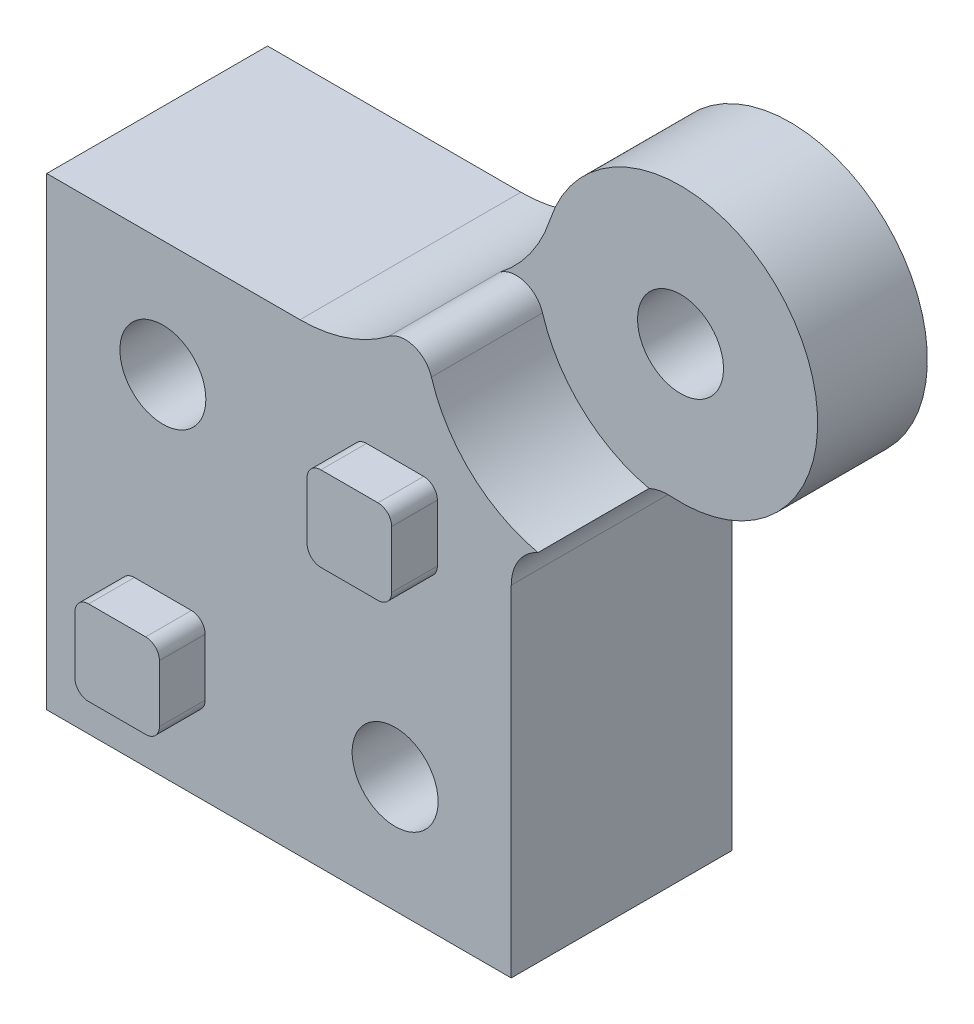
from build123d import *

# Parameters (mm, degrees)
SKETCH2_R             = 2.35
BOSS_EXTRUDE1_DEPTH   = 2.5
BOSS_EXTRUDE1_2_DEPTH = 2.5
SKETCH2_W             = 4.6228
SKETCH2_H             = 4.6228
BOSS_EXTRUDE1_3_DEPTH = 2.5
BOSS_EXTRUDE1_4_DEPTH = 2.5
BOSS_EXTRUDE2_DEPTH   = 6.075
SKETCH6_R             = 2.35
CUT_EXTRUDE1_DEPTH    = 201.98763799
SKETCH4_R             = 7.5
SKETCH4_R_2           = 2.35
BOSS_EXTRUDE4_DEPTH   = 6
FILLET2_R             = 2.5
FILLET3_R             = 8
SKETCH7_R             = 2.35
CUT_EXTRUDE2_DEPTH    = 215.594236042
FILLET4_R             = 1.5
FILLET5_R             = 0.75


with BuildPart() as part:
    # Sketch2 → Boss-Extrude1 (new body)
    with BuildSketch(Plane.XY):
        with Locations((44.45, 184.15)):
            Circle(SKETCH2_R)
    extrude(amount=BOSS_EXTRUDE1_DEPTH)


with BuildPart() as body_2:
    # Sketch2 → Boss-Extrude1 2 (new body)
    with BuildSketch(Plane.XY):
        with Locations((57.15, 171.45)):
            Circle(SKETCH2_R)
    extrude(amount=BOSS_EXTRUDE1_2_DEPTH)


with BuildPart() as body_3:
    # Sketch2 → Boss-Extrude1 3 (new body)
    with BuildSketch(Plane.XY):
        with Locations((57.15, 184.15)):
            Rectangle(SKETCH2_W, SKETCH2_H)
    extrude(amount=BOSS_EXTRUDE1_3_DEPTH)



with BuildPart() as body_4:
    # Sketch2 → Boss-Extrude1 4 (new body)
    with BuildSketch(Plane.XY):
        with Locations((44.45, 171.45)):
            Rectangle(SKETCH2_W, SKETCH2_H)
    extrude(amount=BOSS_EXTRUDE1_4_DEPTH)


with BuildPart() as body_3_1:
    add(body_3.part)

    add(body_4.part)  # Boss-Extrude2 merges body 4
    # Sketch3 → Boss-Extrude2 (add)
    with BuildSketch(Plane.XY):
        with BuildLine():
            Line((63.5, 186.4614), (63.5, 165.1))
            Line((63.5, 165.1), (38.1, 165.1))
            Line((38.1, 165.1), (38.1, 190.5))
            Line((38.1, 190.5), (59.4614, 190.5))
            ThreePointArc((59.4614, 190.5), (61.102474131, 188.102474131), (63.5, 186.4614))
        make_face()
    extrude(amount=-BOSS_EXTRUDE2_DEPTH)


with BuildPart() as cut_extrude1_tool:
    # Sketch6 → Cut-Extrude1 (new, through all)
    with BuildSketch(Plane.XY.offset(2.5)):
        with Locations((44.45, 184.15)):
            Circle(SKETCH6_R)
        with Locations((57.15, 171.45)):
            Circle(SKETCH6_R)
    extrude(amount=-CUT_EXTRUDE1_DEPTH)


with BuildPart() as part_1:
    add(part.part)

    # Cut-Extrude1: cut by cut_extrude1_tool
    add(cut_extrude1_tool.part, mode=Mode.SUBTRACT)


with BuildPart() as body_2_1:
    add(body_2.part)

    # Cut-Extrude1: cut by cut_extrude1_tool
    add(cut_extrude1_tool.part, mode=Mode.SUBTRACT)


with BuildPart() as body_3_2:
    add(body_3_1.part)

    # Cut-Extrude1: cut by cut_extrude1_tool
    add(cut_extrude1_tool.part, mode=Mode.SUBTRACT)

    # Sketch4 → Boss-Extrude4 (add)
    # profile 1 of 3: a face of its own
    with BuildSketch(Plane(origin=(0, 0, -6.075), x_dir=(-1, 0, 0), z_dir=(0, 0, -1))):
        with Locations((-66.681980515, 193.681980515)):
            Circle(SKETCH4_R)
        with Locations((-66.681980515, 193.681980515)):
            Circle(SKETCH4_R_2, mode=Mode.SUBTRACT)
    # profile 2 of 3: a face of its own
    with BuildSketch(Plane(origin=(0, 0, -6.075), x_dir=(-1, 0, 0), z_dir=(0, 0, -1))):
        with BuildLine():
            Line((-38.1, 190.5), (-59.4614, 190.5))
            ThreePointArc((-59.4614, 190.5), (-61.102474131, 188.102474131), (-63.5, 186.4614))
            Line((-63.5, 186.4614), (-63.5, 165.1))
            Line((-63.5, 165.1), (-38.1, 165.1))
            Line((-38.1, 165.1), (-38.1, 190.5))
        make_face()
    # profile 3 of 3: a face of its own
    with BuildSketch(Plane(origin=(0, 0, -6.075), x_dir=(-1, 0, 0), z_dir=(0, 0, -1))):
        with BuildLine():
            ThreePointArc((-63.5, 186.4614), (-61.102474131, 188.102474131), (-59.4614, 190.5))
            Line((-59.4614, 190.5), (-59.890441662, 190.5))
            ThreePointArc((-59.890441662, 190.5), (-61.378679656, 188.378679656), (-63.5, 186.890441662))
            Line((-63.5, 186.890441662), (-63.5, 186.4614))
        make_face()
    extrude(amount=BOSS_EXTRUDE4_DEPTH)

    # Fillet2
    fillet2_edges = [body_3_2.edges().sort_by_distance(p)[0] for p in [
        (63.5, 186.890441662, -9.075),
    ]]
    fillet(fillet2_edges, radius=FILLET2_R)

    # Fillet3
    # the kernel refuses this fillet: 8 mm, written as the material it adds along each edge
    with BuildSketch(Plane(origin=(59.890441662, 190.5, 13.776565592), x_dir=(-1, 0, 0), z_dir=(0, 0, -1))) as fillet3_piece_1_section:
        with BuildLine():
            CenterArc((7.940626237, 8), FILLET3_R, 198.10985807, 71.89014193)
            ThreePointArc((0.336928126, 5.513280266), (0.694495171, 2.724493268), (0, 0))
            Line((0, 0), (7.940626237, 0))
        make_face()
    fillet3_piece_1 = extrude(amount=25.851565592, mode=Mode.PRIVATE)
    fillet3_piece_1 = fillet3_piece_1 - Plane(origin=(66.681980515, 193.681980515, -3.0375), x_dir=(-0.9150847933660875, -0.40326147962599274, 0), z_dir=(0, 0, 1)) * Cylinder(7.8906136, 84, mode=Mode.PRIVATE)
    fillet3_piece_1 = split(fillet3_piece_1, bisect_by=Plane(origin=(57.125105601, 191.419685935, 0), z_dir=(0, 0, -1)), keep=Keep.TOP, mode=Mode.PRIVATE)
    fillet3_piece_1 = split(fillet3_piece_1, bisect_by=Plane(origin=(57.125105601, 191.419685935, -6.075), z_dir=(0, 0, 1)), keep=Keep.TOP, mode=Mode.PRIVATE)
    add(fillet3_piece_1)
    with BuildSketch(Plane(origin=(59.890441662, 190.5, -6.075), x_dir=(-1, 0, 0), z_dir=(0, 0, -1))) as fillet3_piece_2_section:
        with BuildLine():
            CenterArc((7.940626237, 8), FILLET3_R, 198.10985807, 71.89014193)
            ThreePointArc((0.336928126, 5.513280266), (0.694495171, 2.724493268), (0, 0))
            Line((0, 0), (7.940626237, 0))
        make_face()
    fillet3_piece_2 = extrude(amount=6, mode=Mode.PRIVATE)
    fillet3_piece_2 = fillet3_piece_2 - Plane(origin=(66.681980515, 193.681980515, -9.075), x_dir=(-0.9150847933660875, -0.40326147962599274, 0), z_dir=(0, 0, 1)) * Cylinder(7.8906136, 44, mode=Mode.PRIVATE)
    add(fillet3_piece_2)
    with BuildSketch(Plane(origin=(59.890441662, 190.5, -6.075), x_dir=(-1, 0, 0), z_dir=(0, 0, -1))) as fillet3_piece_3_section:
        with BuildLine():
            CenterArc((7.940626237, 8), FILLET3_R, 198.10985807, 71.89014193)
            ThreePointArc((0.336928126, 5.513280266), (0.694495171, 2.724493268), (0, 0))
            Line((0, 0), (7.940626237, 0))
        make_face()
    fillet3_piece_3 = extrude(amount=6, mode=Mode.PRIVATE)
    fillet3_piece_3 = fillet3_piece_3 & Plane(origin=(66.681980515, 193.681980515, -9.075), x_dir=(-0.9150847933660875, -0.40326147962599274, 0), z_dir=(0, 0, 1)) * Cylinder(7.8906136, 44, mode=Mode.PRIVATE)
    add(fillet3_piece_3)

    # Sketch7 → Cut-Extrude2 (cut, through all)
    with BuildSketch(Plane.XY.offset(-6.075)):
        with Locations((44.45, 184.15)):
            Circle(SKETCH7_R)
        with Locations((57.15, 171.45)):
            Circle(SKETCH7_R)
    extrude(amount=-CUT_EXTRUDE2_DEPTH, mode=Mode.SUBTRACT)

    # Fillet4
    fillet4_edges = [body_3_2.edges().sort_by_distance(p)[0] for p in [
        (58.824977937, 194.409506089, -3.0375),
    ]]
    fillet(fillet4_edges, radius=FILLET4_R)

    # Fillet5
    fillet5_edges = [body_3_2.edges().sort_by_distance(p)[0] for p in [
        (46.7614, 173.7614, 1.25),
        (42.1386, 173.7614, 1.25),
        (42.1386, 169.1386, 1.25),
        (46.7614, 169.1386, 1.25),
        (59.4614, 181.8386, 1.25),
        (54.8386, 181.8386, 1.25),
        (54.8386, 186.4614, 1.25),
        (59.4614, 186.4614, 1.25),
    ]]
    fillet(fillet5_edges, radius=FILLET5_R)


solid = body_3_2.part
